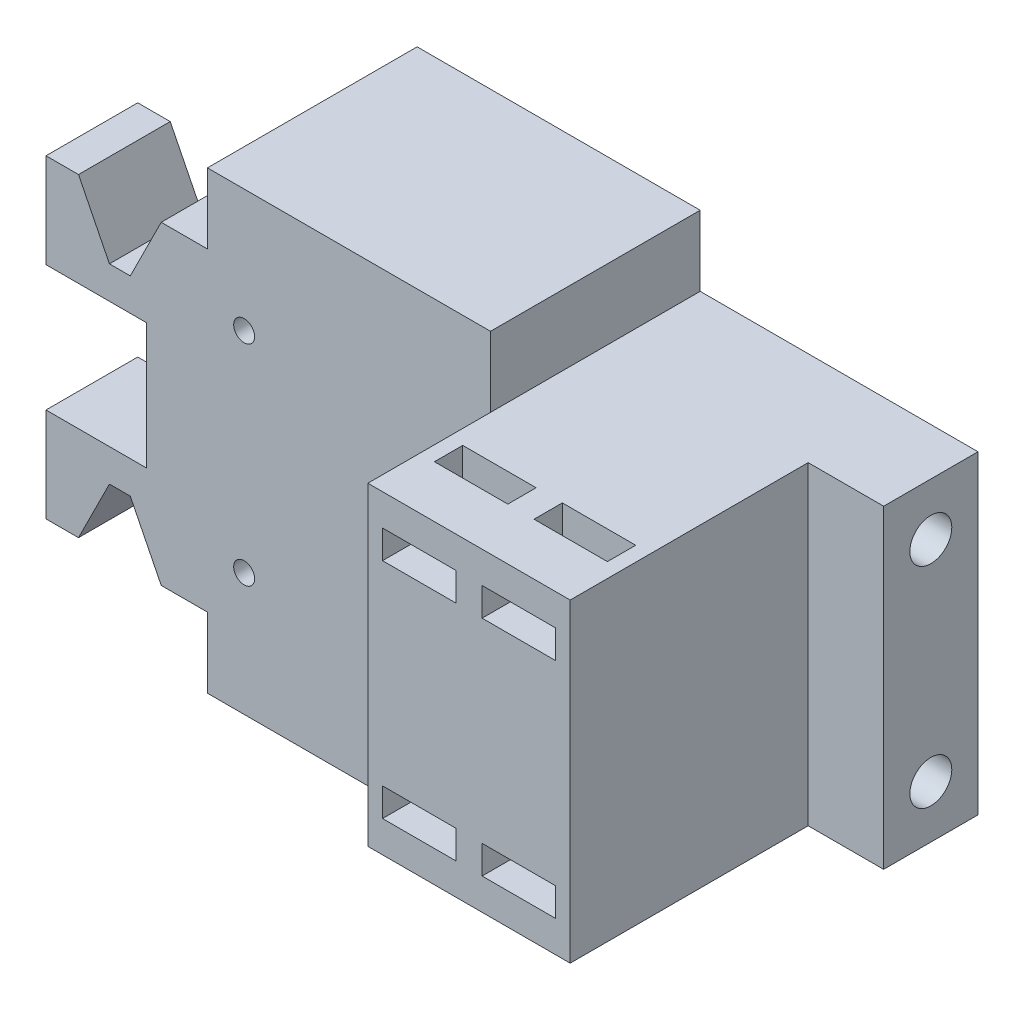
from build123d import *

# Parameters (mm, degrees)
BOSS_EXTRUDE1_DEPTH                     = 20
EARKNOTCH_SKETCH2_W                     = 7.1
EARKNOTCH_SKETCH2_H                     = 30
EARKNOTCH_CUT_EXTRUDE1_DEPTH            = 11.25
TOPHOLES_SKETCH3_R                      = 2.3
TOPHOLES_CUT_EXTRUDE2_DEPTH             = 4
FRONTHOLES_SKETCH1_R                    = 2
FRONTHOLES_CUT_EXTRUDE1_DEPTH           = 7
REARMOUNTINGHOLES_SKETCH2_R             = 1
REARMOUNTINGHOLES_CUT_EXTRUDE2_DEPTH    = 81.585978929
REARMOUNTINGHOLESBORESKETCH4_R          = 2
REARMOUNTINGHOLESBORECUT_EXTRUDE2_DEPTH = 4
BLOCKUNDERRAIL_SKETCH1_W                = 26.5
BLOCKUNDERRAIL_SKETCH1_H                = 30
BLOCKUNDERRAIL_BOSS_EXTRUDE2_DEPTH      = 11.7
REARRIBBONHOLES_SKETCH2_W               = 7
REARRIBBONHOLES_SKETCH2_H               = 2.7
REARRIBBONHOLES_CUT_EXTRUDE1_DEPTH      = 7.65
RIGHTRIBBONHOLES_SKETCH4_W              = 7
RIGHTRIBBONHOLES_SKETCH4_H              = 2.7
RIGHTRIBBONHOLES_CUT_EXTRUDE2_DEPTH     = 5.7
LEFTRIBBONHOLES_SKETCH3_W               = 7
LEFTRIBBONHOLES_SKETCH3_H               = 2.7
LEFTRIBBONHOLES_CUT_EXTRUDE2_DEPTH      = 5.7
BOTTOMCLAMPMOUNTINGHOLESSKETCH3_R       = 2
BOTTOMCLAMPMOUNTHOLESCUT_EXTRUDE1_DEPTH = 4.1
RIBBONHOLEFILLET1_R                     = 2.7
RIBBONHOLEFILLET2_R                     = 2.7
RIBBONHOLEFILLET3_R                     = 2.7
RIBBONHOLEFILLET4_R                     = 2.7
EXCESSENDSKETCH1_W                      = 7.2
EXCESSENDSKETCH1_H                      = 30
EXCESSENDCUT_EXTRUDE1_DEPTH             = 22.7


with BuildPart() as part:
    # BackFace-Sketch1 → Boss-Extrude1 (new body)
    with BuildSketch(Plane.XY):
        Polygon((0, 0), (0, 9), (9.6, 9), (9.6, 21), (0, 21), (0, 30), (3.1, 30), (6.05, 24.095975949), (8.04, 24.095975949), (10.99, 30), (15.4, 30), (15.4, 36.7), (42.4, 36.7), (42.4, 30), (68.9, 30), (68.9, 0), (42.4, 0), (42.4, -6.7), (15.4, -6.7), (15.4, 0), (10.99, 0), (8.04, 5.904024051), (6.05, 5.904024051), (3.1, 0), align=None)
    extrude(amount=BOSS_EXTRUDE1_DEPTH)

    # EarKnotch-Sketch2 → EarKnotch-Cut-Extrude1 (cut)
    with BuildSketch(Plane(origin=(0, 0, 0), x_dir=(-1, 0, 0), z_dir=(0, 0, -1))):
        with Locations((-3.55, 15)):
            Rectangle(EARKNOTCH_SKETCH2_W, EARKNOTCH_SKETCH2_H)
    extrude(amount=-EARKNOTCH_CUT_EXTRUDE1_DEPTH, mode=Mode.SUBTRACT)

    # TopHoles-Sketch3 → TopHoles-Cut-Extrude2 (cut)
    with BuildSketch(Plane.ZY):
        with Locations((15.5, 25.5)):
            Circle(TOPHOLES_SKETCH3_R)
        with Locations((15.5, 4.5)):
            Circle(TOPHOLES_SKETCH3_R)
    extrude(amount=-TOPHOLES_CUT_EXTRUDE2_DEPTH, mode=Mode.SUBTRACT)

    # FrontHoles-Sketch1 → FrontHoles-Cut-Extrude1 (cut)
    with BuildSketch(Plane(origin=(0, 0, 0), x_dir=(-1, 0, 0), z_dir=(0, 0, -1))):
        with Locations((-45.25, 25)):
            Circle(FRONTHOLES_SKETCH1_R)
        with Locations((-45.25, 5)):
            Circle(FRONTHOLES_SKETCH1_R)
        with Locations((-33.25, 25)):
            Circle(FRONTHOLES_SKETCH1_R)
        with Locations((-33.25, 5)):
            Circle(FRONTHOLES_SKETCH1_R)
    extrude(amount=-FRONTHOLES_CUT_EXTRUDE1_DEPTH, mode=Mode.SUBTRACT)

    # RearMountingHoles-Sketch2 → RearMountingHoles-Cut-Extrude2 (cut, through all)
    with BuildSketch(Plane.XY.offset(20)):
        with Locations((18.9, 25)):
            Circle(REARMOUNTINGHOLES_SKETCH2_R)
        with Locations((18.9, 5)):
            Circle(REARMOUNTINGHOLES_SKETCH2_R)
        with Locations((38.9, 25)):
            Circle(REARMOUNTINGHOLES_SKETCH2_R)
        with Locations((38.9, 5)):
            Circle(REARMOUNTINGHOLES_SKETCH2_R)
    extrude(amount=-REARMOUNTINGHOLES_CUT_EXTRUDE2_DEPTH, mode=Mode.SUBTRACT)

    # RearMountingHolesBoreSketch4 → RearMountingHolesBoreCut-Extrude2 (cut)
    with BuildSketch(Plane(origin=(0, 0, 0), x_dir=(-1, 0, 0), z_dir=(0, 0, -1))):
        with Locations((-38.9, 25)):
            Circle(REARMOUNTINGHOLESBORESKETCH4_R)
        with Locations((-18.9, 25)):
            Circle(REARMOUNTINGHOLESBORESKETCH4_R)
        with Locations((-38.9, 5)):
            Circle(REARMOUNTINGHOLESBORESKETCH4_R)
        with Locations((-18.9, 5)):
            Circle(REARMOUNTINGHOLESBORESKETCH4_R)
    extrude(amount=-REARMOUNTINGHOLESBORECUT_EXTRUDE2_DEPTH, mode=Mode.SUBTRACT)

    # BlockUnderRail-Sketch1 → BlockUnderRail-Boss-Extrude2 (add)
    with BuildSketch(Plane.XY.offset(20)):
        with Locations((55.65, 15)):
            Rectangle(BLOCKUNDERRAIL_SKETCH1_W, BLOCKUNDERRAIL_SKETCH1_H)
    extrude(amount=BLOCKUNDERRAIL_BOSS_EXTRUDE2_DEPTH)

    # RearRibbonHoles-Sketch2 → RearRibbonHoles-Cut-Extrude1 (cut)
    with BuildSketch(Plane.XY.offset(31.7)):
        with Locations((47.3, 25.65)):
            Rectangle(REARRIBBONHOLES_SKETCH2_W, REARRIBBONHOLES_SKETCH2_H)
        with Locations((56.8, 25.65)):
            Rectangle(REARRIBBONHOLES_SKETCH2_W, REARRIBBONHOLES_SKETCH2_H)
        with Locations((47.3, 4.35)):
            Rectangle(REARRIBBONHOLES_SKETCH2_W, REARRIBBONHOLES_SKETCH2_H)
        with Locations((56.8, 4.35)):
            Rectangle(REARRIBBONHOLES_SKETCH2_W, REARRIBBONHOLES_SKETCH2_H)
    extrude(amount=-REARRIBBONHOLES_CUT_EXTRUDE1_DEPTH, mode=Mode.SUBTRACT)

    # RightRibbonHoles-Sketch4 → RightRibbonHoles-Cut-Extrude2 (cut)
    with BuildSketch(Plane(origin=(0, 30, 0), x_dir=(1, 0, 0), z_dir=(0, 1, 0))):
        with Locations((47.3, -25.4)):
            Rectangle(RIGHTRIBBONHOLES_SKETCH4_W, RIGHTRIBBONHOLES_SKETCH4_H)
        with Locations((56.8, -25.4)):
            Rectangle(RIGHTRIBBONHOLES_SKETCH4_W, RIGHTRIBBONHOLES_SKETCH4_H)
    extrude(amount=-RIGHTRIBBONHOLES_CUT_EXTRUDE2_DEPTH, mode=Mode.SUBTRACT)

    # LeftRibbonHoles-Sketch3 → LeftRibbonHoles-Cut-Extrude2 (cut)
    with BuildSketch(Plane.XZ):
        with Locations((47.3, 25.4)):
            Rectangle(LEFTRIBBONHOLES_SKETCH3_W, LEFTRIBBONHOLES_SKETCH3_H)
        with Locations((56.8, 25.4)):
            Rectangle(LEFTRIBBONHOLES_SKETCH3_W, LEFTRIBBONHOLES_SKETCH3_H)
    extrude(amount=-LEFTRIBBONHOLES_CUT_EXTRUDE2_DEPTH, mode=Mode.SUBTRACT)

    # BottomClampMountingHolesSketch3 → BottomClampMountHolesCut-Extrude1 (cut)
    with BuildSketch(Plane(origin=(68.9, 0, 0), x_dir=(0, 0, -1), z_dir=(1, 0, 0))):
        with Locations((-4.5, 25)):
            Circle(BOTTOMCLAMPMOUNTINGHOLESSKETCH3_R)
        with Locations((-4.5, 5)):
            Circle(BOTTOMCLAMPMOUNTINGHOLESSKETCH3_R)
    extrude(amount=-BOTTOMCLAMPMOUNTHOLESCUT_EXTRUDE1_DEPTH, mode=Mode.SUBTRACT)

    # RibbonHoleFillet1
    ribbonholefillet1_edges = [part.edges().sort_by_distance(p)[0] for p in [
        (56.8, 5.7, 24.05),
    ]]
    fillet(ribbonholefillet1_edges, radius=RIBBONHOLEFILLET1_R)

    # RibbonHoleFillet2
    ribbonholefillet2_edges = [part.edges().sort_by_distance(p)[0] for p in [
        (47.3, 5.7, 24.05),
    ]]
    fillet(ribbonholefillet2_edges, radius=RIBBONHOLEFILLET2_R)

    # RibbonHoleFillet3
    ribbonholefillet3_edges = [part.edges().sort_by_distance(p)[0] for p in [
        (56.8, 24.3, 24.05),
    ]]
    fillet(ribbonholefillet3_edges, radius=RIBBONHOLEFILLET3_R)

    # RibbonHoleFillet4
    ribbonholefillet4_edges = [part.edges().sort_by_distance(p)[0] for p in [
        (47.3, 24.3, 24.05),
    ]]
    fillet(ribbonholefillet4_edges, radius=RIBBONHOLEFILLET4_R)

    # ExcessEndSketch1 → ExcessEndCut-Extrude1 (cut)
    with BuildSketch(Plane.XY.offset(31.7)):
        with Locations((65.3, 15)):
            Rectangle(EXCESSENDSKETCH1_W, EXCESSENDSKETCH1_H)
    extrude(amount=-EXCESSENDCUT_EXTRUDE1_DEPTH, mode=Mode.SUBTRACT)


solid = part.part
